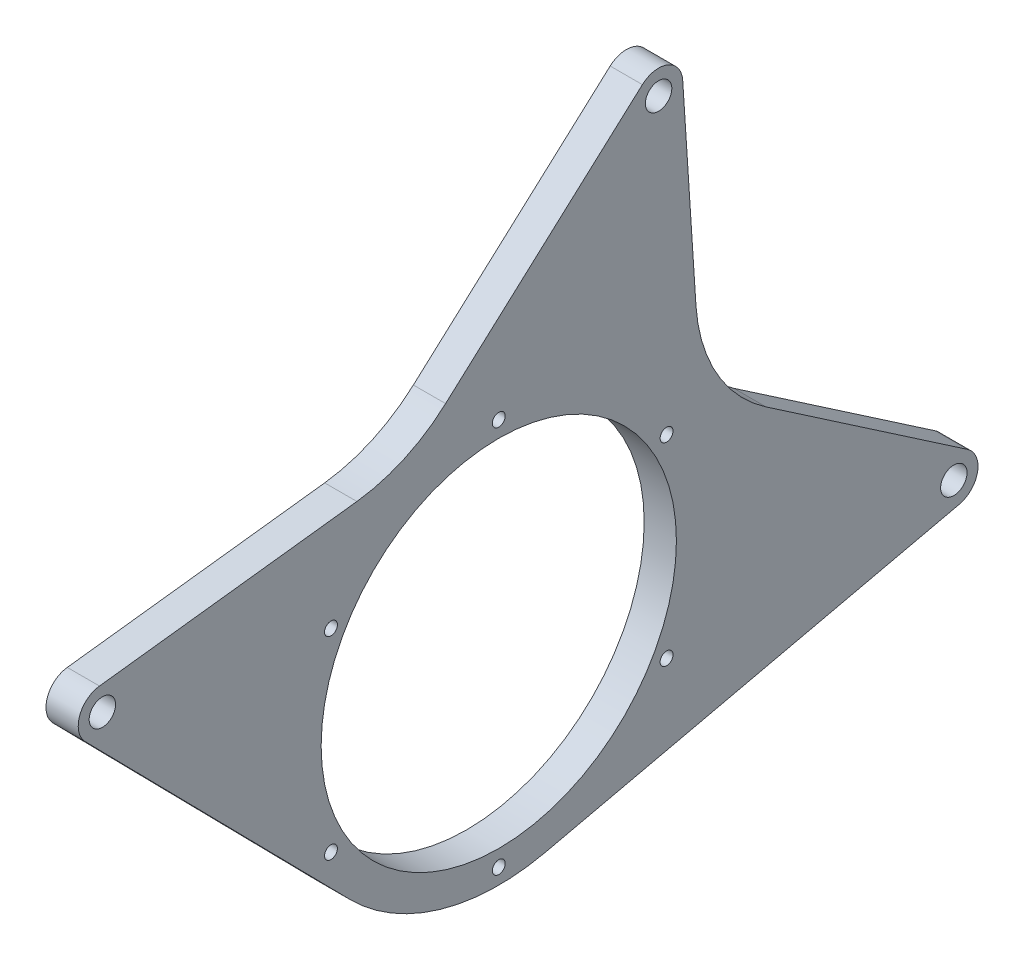
from build123d import *

# Parameters (mm, degrees)
BOSS_EXTRUDE1_OUTLINE_R = 55.125
BOSS_EXTRUDE1_DEPTH     = 10
FILLET1_R               = 50
SKETCH4_R               = 2
CUT_EXTRUDE1_DEPTH      = 1336.164989569
SKETCH5_R               = 4.1
CUT_EXTRUDE2_DEPTH      = 1336.164989569


# Read off the part's stored shape, not the designer's step: Boss-Extrude1
with BuildPart() as part:
    # Boss-Extrude1 outline → Boss-Extrude1 (new body)
    with BuildSketch(Plane.ZY.offset(-1.65)):
        with BuildLine():
            Line((-1257.876937074, 266.919395505), (-1129.454602927, 237.627573392))
            ThreePointArc((-1129.454602927, 237.627573392), (-1096.744938567, 238.616085951), (-1068.662335154, 255.416880135))
            Line((-1068.662335154, 255.416880135), (-986.642796778, 338.794101601))
            ThreePointArc((-986.642796778, 338.794101601), (-984.910512742, 346.53132054), (-991.089695369, 351.499526147))
            Line((-991.089695369, 351.499526147), (-1086.722744118, 363.055830047))
            Line((-1086.722744118, 363.055830047), (-1159.562924749, 428.883221767))
            ThreePointArc((-1159.562924749, 428.883221767), (-1167.409525964, 430.269317516), (-1172.0754788, 423.810269894))
            Line((-1172.0754788, 423.810269894), (-1177.78637409, 336.842019695))
            Line((-1177.78637409, 336.842019695), (-1260.437346066, 280.42610587))
            ThreePointArc((-1260.437346066, 280.42610587), (-1263.57786788, 272.834732614), (-1257.876937074, 266.919395505))
        make_face()
        with Locations((-1115, 301)):
            Circle(BOSS_EXTRUDE1_OUTLINE_R, mode=Mode.SUBTRACT)
    extrude(amount=BOSS_EXTRUDE1_DEPTH)

    # Fillet1
    fillet1_edges = [part.edges().sort_by_distance(p)[0] for p in [
        (-3.35, 336.842019695, -1177.78637409),
        (-3.35, 363.055830047, -1086.722744118),
    ]]
    fillet(fillet1_edges, radius=FILLET1_R)

    # Sketch4 → Cut-Extrude1 (cut, through all)
    with BuildSketch(Plane.ZY.offset(-1.65)):
        with Locations((-1062.930222597, 331.0625)):
            Circle(SKETCH4_R)
        with Locations((-1115, 361.125)):
            Circle(SKETCH4_R)
        with Locations((-1062.930222597, 270.9375)):
            Circle(SKETCH4_R)
        with Locations((-1115, 240.875)):
            Circle(SKETCH4_R)
        with Locations((-1167.069777403, 270.9375)):
            Circle(SKETCH4_R)
        with Locations((-1167.069777403, 331.0625)):
            Circle(SKETCH4_R)
    extrude(amount=CUT_EXTRUDE1_DEPTH, mode=Mode.SUBTRACT)

    # Sketch5 → Cut-Extrude2 (cut, through all)
    with BuildSketch(Plane.ZY.offset(-1.65)):
        with Locations((-1164.591596996, 423.318830027)):
            Circle(SKETCH5_R)
        with Locations((-991.989450415, 344.053692355)):
            Circle(SKETCH5_R)
        with Locations((-1256.209098275, 274.231598575)):
            Circle(SKETCH5_R)
    extrude(amount=CUT_EXTRUDE2_DEPTH, mode=Mode.SUBTRACT)


solid = part.part
